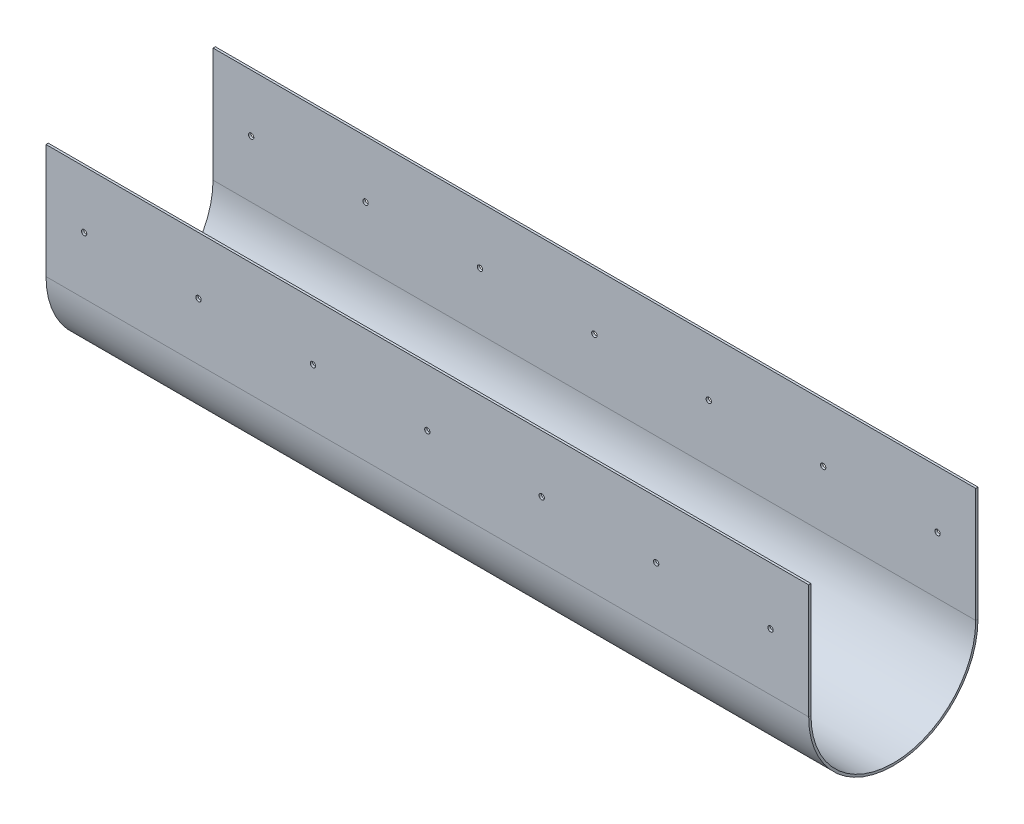
from build123d import *

# Parameters (mm, degrees)
OTHER_START              = -500
OTHER_2_DEPTH            = 1000
CUT_EXTRUDE_3_DEPTH      = 534.686237409
CUT_EXTRUDE_3_DEPTH_BACK = 534.686237409
SKETCH_11_R              = 3.5


# Read off the part's stored shape, not the designer's step: Элемент по сечениям сгиба2
with BuildPart() as part:
    # Other 2 outline → Other 2 (new body)
    with BuildSketch(Plane.YZ.offset(OTHER_START)):
        with BuildLine():
            Line((0, -111), (150, -111))
            Line((150, -111), (150, -108))
            Line((150, -108), (0, -108))
            ThreePointArc((0, -108), (-108, 0), (0, 108))
            Line((0, 108), (150, 108))
            Line((150, 108), (150, 111))
            Line((150, 111), (0, 111))
            ThreePointArc((0, 111), (-111, 0), (0, -111))
        make_face()
    extrude(amount=OTHER_2_DEPTH)

    # Эскиз11 → Вырез-Вытянуть3 (cut, two sides: drawn at the far end of the back side and taken through both)
    with BuildSketch(Plane.XY.offset(-CUT_EXTRUDE_3_DEPTH_BACK)):
        with Locations((450, 75)):
            Circle(SKETCH_11_R)
        with Locations((300, 75)):
            Circle(SKETCH_11_R)
        with Locations((150, 75)):
            Circle(SKETCH_11_R)
        with Locations((0, 75)):
            Circle(SKETCH_11_R)
        with Locations((-150, 75)):
            Circle(SKETCH_11_R)
        with Locations((-300, 75)):
            Circle(SKETCH_11_R)
        with Locations((-450, 75)):
            Circle(SKETCH_11_R)
    extrude(amount=CUT_EXTRUDE_3_DEPTH + CUT_EXTRUDE_3_DEPTH_BACK, mode=Mode.SUBTRACT)


solid = part.part
